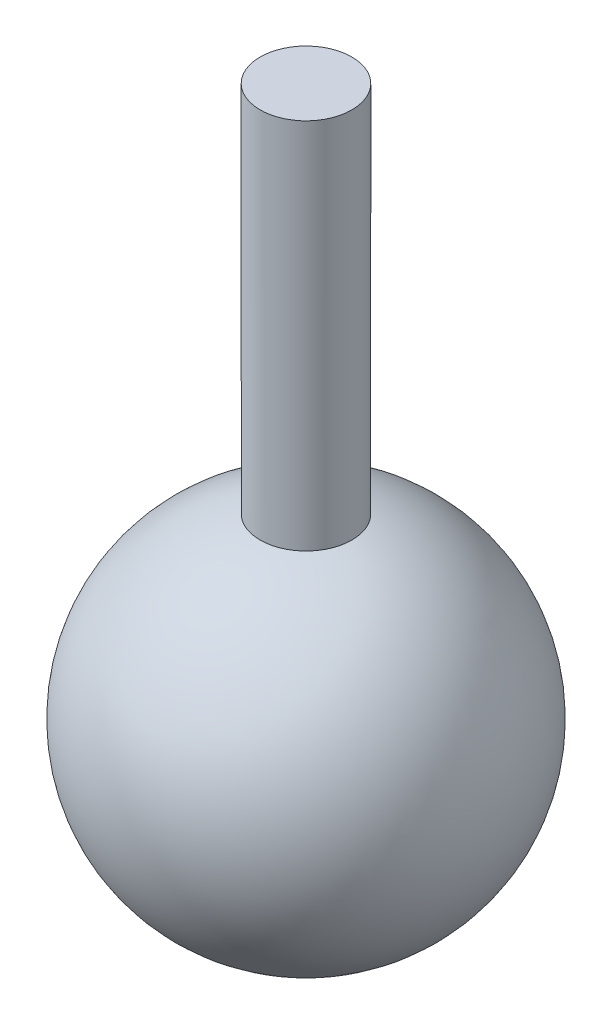
from build123d import *


with BuildPart() as part:
    # Sketch1 → Revolve1 (revolve)
    with BuildSketch(Plane.XY):
        with BuildLine():
            Line((-3.175, 38.1), (-3.175, 12.296722124))
            ThreePointArc((-3.175, 12.296722124), (-12.598777143, -1.600254515), (0, -12.7))
            Line((0, -12.7), (0, 38.1))
            Line((0, 38.1), (-3.175, 38.1))
        make_face()
    revolve(axis=Axis((0, 12.7, 0), (0, 1, 0)))


solid = part.part
